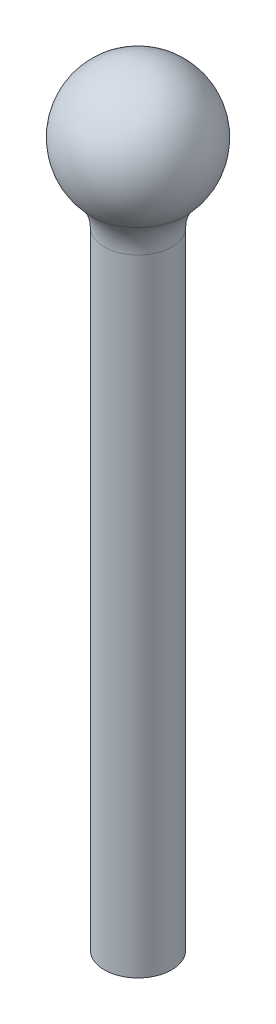
from build123d import *


with BuildPart() as part:
    # Sketch1 → Revolve1 (revolve)
    with BuildSketch(Plane.XY):
        with BuildLine():
            Line((0, 6.75), (0, -18.25))
            Line((0, -18.25), (1.25, -18.25))
            Line((1.25, -18.25), (1.25, -73.25))
            Line((1.25, -73.25), (3.5, -73.25))
            Line((3.5, -73.25), (3.5, -8.11249037))
            ThreePointArc((3.5, -8.11249037), (3.858604392, -6.253069275), (4.882978723, -4.660366808))
            ThreePointArc((4.882978723, -4.660366808), (6.205641625, 2.655656609), (0, 6.75))
        make_face()
    revolve(axis=Axis((0, 6.75, 0), (0, -1, 0)))


solid = part.part
